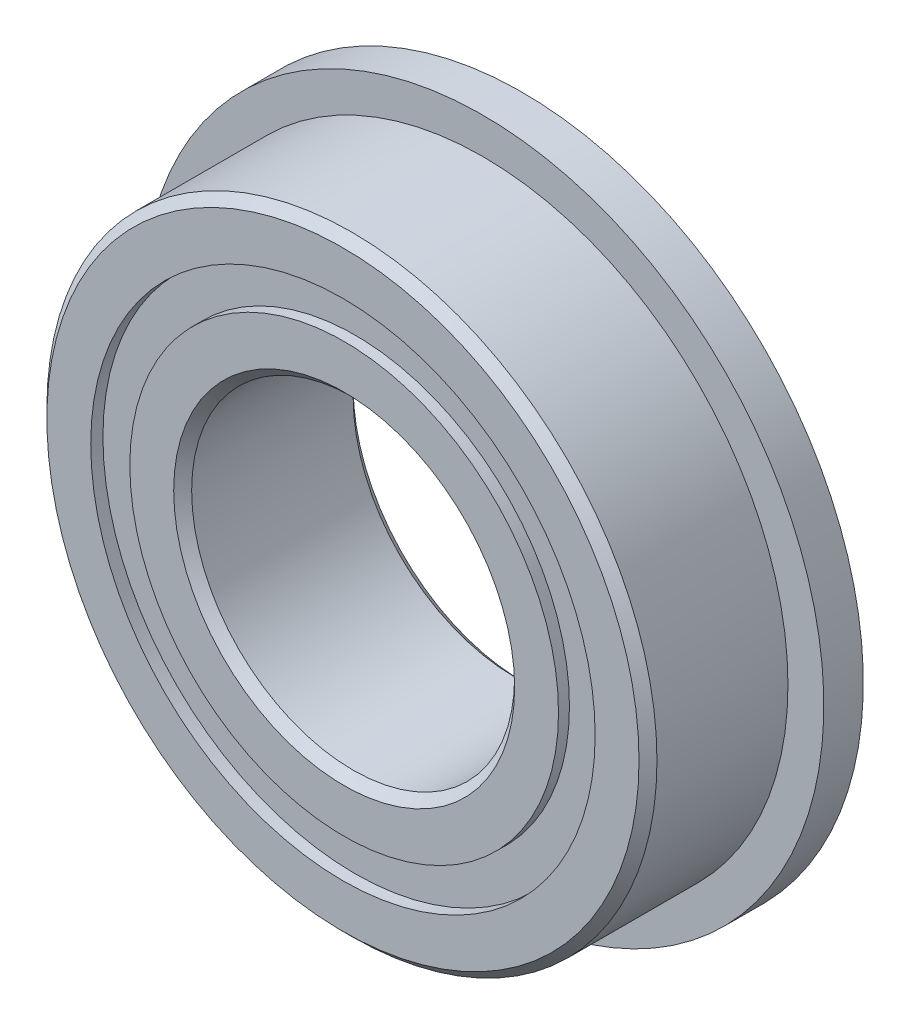
from build123d import *

# Parameters (mm, degrees)
CIRPATTERN1_COUNT    = 12
SKETCH5_W            = 1.145042615
SKETCH5_H            = 1.054945054
SKETCH6_W            = 1.1
SKETCH6_H            = 2.472527473
SCALE1_OUTLINE_W     = 0.055555556
SCALE1_OUTLINE_H     = 0.117750197
SCALE1_START         = 1.229957385
SCALE1_5_OUTLINE_R   = 6.636141636
SCALE1_5_OUTLINE_R_2 = 5.972527473
SCALE1_5_DEPTH       = 1.145042615
SCALE1_START_2       = 1.166343906
SCALE1_6_OUTLINE_R   = 7.808302808
SCALE1_6_OUTLINE_R_2 = 6.636141636
SCALE1_6_DEPTH       = 1.272269573
SCALE1_START_3       = -2.375
SCALE1_7_OUTLINE_R   = 6.636141636
SCALE1_7_OUTLINE_R_2 = 5.972527473
SCALE1_7_DEPTH       = 1.145042615
SCALE1_START_4       = -2.438613479
SCALE1_8_OUTLINE_R   = 7.808302808
SCALE1_8_OUTLINE_R_2 = 6.636141636
SCALE1_8_DEPTH       = 1.272269573


with BuildPart() as part:
    # Sketch1 → Revolve1 (revolve)
    with BuildSketch(Plane(origin=(0, 0, 0), x_dir=(0, 0, -1), z_dir=(1, 0, 0)), mode=Mode.PRIVATE) as revolve1_sk:
        with BuildLine():
            Line((2.25, 8.5), (-2.25, 8.5))
            Line((-2.25, 8.5), (-2.5, 8.25))
            Line((-2.5, 8.25), (-2.5, 7.027472527))
            Line((-2.5, 7.027472527), (-1.111111111, 7.027472527))
            ThreePointArc((-1.111111111, 7.027472527), (0, 7.729957385), (1.111111111, 7.027472527))
            Line((1.111111111, 7.027472527), (2.5, 7.027472527))
            Line((2.5, 7.027472527), (2.5, 8.25))
            Line((2.5, 8.25), (2.25, 8.5))
        make_face()
    revolve(revolve1_sk.sketch.rotate(Axis((0, 0, 2.5), (0, 0, -1)), 90), axis=Axis((0, 0, 2.5), (0, 0, -1)))

    # Sketch6 → Revolve6 (revolve)
    with BuildSketch(Plane(origin=(0, 0, 0), x_dir=(0, 0, -1), z_dir=(1, 0, 0)), mode=Mode.PRIVATE) as revolve6_sk:
        with Locations((1.95, 8.263736264)):
            Rectangle(SKETCH6_W, SKETCH6_H)
    revolve(revolve6_sk.sketch.rotate(Axis((0, 0, -2.5), (0, 0, 1)), 270), axis=Axis((0, 0, -2.5), (0, 0, 1)))

    # Scale1: read off the stored shape, not the designer's step
    # Scale1 outline → Scale1 (revolve, cut)
    with BuildSketch(Plane.XZ):
        with Locations((9.472222222, -1.458875099)):
            Rectangle(SCALE1_OUTLINE_W, SCALE1_OUTLINE_H)
        with BuildLine():
            Line((7.808302808, 1.27237326), (7.808302808, 2.5))
            Line((7.808302808, 2.5), (7.027472527, 2.5))
            Line((7.027472527, 2.5), (7.027472527, 1.111111111))
            ThreePointArc((7.027472527, 1.111111111), (7.729957385, 0), (7.027472527, -1.111111111))
            Line((7.027472527, -1.111111111), (7.027472527, -2.5))
            Line((7.027472527, -2.5), (7.808302808, -2.5))
            Line((7.808302808, -2.5), (7.808302808, -1.196762542))
            ThreePointArc((7.808302808, -1.196762542), (8.226746068, -0.888790669), (8.5, -0.446892802))
            Line((8.5, -0.446892802), (8.5, 0.52250352))
            ThreePointArc((8.5, 0.52250352), (8.226746068, 0.964401387), (7.808302808, 1.27237326))
        make_face()
    revolve(axis=Axis((0, 0, 0), (0, 0, 1)), mode=Mode.SUBTRACT)

    # Scale1 2 outline → Scale1 2 (revolve)
    with BuildSketch(Plane.XZ):
        with BuildLine():
            Line((9.444444444, 2.537805359), (9.166666667, 2.815583137))
            Line((9.166666667, 2.815583137), (7.808302808, 2.815583137))
            Line((7.808302808, 2.815583137), (7.808302808, 2.5))
            Line((7.808302808, 2.5), (8.25, 2.5))
            Line((8.25, 2.5), (8.5, 2.25))
            Line((8.5, 2.25), (8.5, 0.52250352))
            ThreePointArc((8.5, 0.52250352), (8.588841539, 0.037805359), (8.5, -0.446892802))
            Line((8.5, -0.446892802), (8.5, -1.4))
            Line((8.5, -1.4), (9.444444444, -1.4))
            Line((9.444444444, -1.4), (9.444444444, 2.537805359))
        make_face()
        Polygon((10.555555556, -1.517750197), (9.5, -1.517750197), (9.5, -2.5), (7.808302808, -2.5), (7.808302808, -2.739972419), (10.555555556, -2.739972419), align=None)
    revolve(axis=Axis((0, 0, 0), (0, 0, 1)))


with BuildPart() as body_2:
    # Sketch3 → Revolve3 (revolve)
    with BuildSketch(Plane(origin=(0, 0, 0), x_dir=(0, 0, -1), z_dir=(1, 0, 0)), mode=Mode.PRIVATE) as revolve3_sk:
        with BuildLine():
            Line((-2.5, 5.972527473), (-1.111111111, 5.972527473))
            ThreePointArc((-1.111111111, 5.972527473), (0, 5.270042615), (1.111111111, 5.972527473))
            Line((1.111111111, 5.972527473), (2.5, 5.972527473))
            Line((2.5, 5.972527473), (2.5, 4.75))
            Line((2.5, 4.75), (2.25, 4.5))
            Line((2.25, 4.5), (-2.25, 4.5))
            Line((-2.25, 4.5), (-2.5, 4.75))
            Line((-2.5, 4.75), (-2.5, 5.972527473))
        make_face()
    revolve(revolve3_sk.sketch.rotate(Axis((0, 0, 2.5), (0, 0, -1)), 90), axis=Axis((0, 0, 2.5), (0, 0, -1)))

    # Scale1 3 outline → Scale1 3 (revolve, cut)
    with BuildSketch(Plane.XZ):
        Polygon((5, -2.5), (5, 2.5), (4.75, 2.5), (4.5, 2.25), (4.5, -2.25), (4.75, -2.5), align=None)
    revolve(axis=Axis((0, 0, 0), (0, 0, 1)), mode=Mode.SUBTRACT)

    # Scale1 4 outline → Scale1 4 (revolve)
    with BuildSketch(Plane.XZ):
        with BuildLine():
            Line((5.277777778, 2.777777778), (5, 2.5))
            Line((5, 2.5), (5.972527473, 2.5))
            Line((5.972527473, 2.5), (5.972527473, 1.111111111))
            ThreePointArc((5.972527473, 1.111111111), (5.270042615, 0), (5.972527473, -1.111111111))
            Line((5.972527473, -1.111111111), (5.972527473, -2.5))
            Line((5.972527473, -2.5), (5, -2.5))
            Line((5, -2.5), (5.277777778, -2.777777778))
            Line((5.277777778, -2.777777778), (6.636141636, -2.777777778))
            Line((6.636141636, -2.777777778), (6.636141636, -1.234567901))
            ThreePointArc((6.636141636, -1.234567901), (5.855602906, 0), (6.636141636, 1.234567901))
            Line((6.636141636, 1.234567901), (6.636141636, 2.777777778))
            Line((6.636141636, 2.777777778), (5.277777778, 2.777777778))
        make_face()
    revolve(axis=Axis((0, 0, 0), (0, 0, 1)))


with BuildPart() as body_3:
    # Sketch4 → Revolve4 (revolve)
    with BuildSketch(Plane(origin=(0, 0, 0), x_dir=(0, 0, -1), z_dir=(1, 0, 0))):
        with BuildLine():
            Line((-1.229957385, 6.5), (1.229957385, 6.5))
            ThreePointArc((1.229957385, 6.5), (0, 7.729957385), (-1.229957385, 6.5))
        make_face()
    revolve(axis=Axis((0, 6.5, 1.229957385), (0, 0, -1)))


with BuildPart() as cirpattern1_1:
    # CirPattern1: pattern copy
    add(body_3.part.rotate(Axis((0, 0, 0), (0, 0, 1)), 1 * 360 / CIRPATTERN1_COUNT))


with BuildPart() as cirpattern1_2:
    # CirPattern1: pattern copy
    add(body_3.part.rotate(Axis((0, 0, 0), (0, 0, 1)), 2 * 360 / CIRPATTERN1_COUNT))


with BuildPart() as cirpattern1_3:
    # CirPattern1: pattern copy
    add(body_3.part.rotate(Axis((0, 0, 0), (0, 0, 1)), 3 * 360 / CIRPATTERN1_COUNT))


with BuildPart() as cirpattern1_4:
    # CirPattern1: pattern copy
    add(body_3.part.rotate(Axis((0, 0, 0), (0, 0, 1)), 4 * 360 / CIRPATTERN1_COUNT))


with BuildPart() as cirpattern1_5:
    # CirPattern1: pattern copy
    add(body_3.part.rotate(Axis((0, 0, 0), (0, 0, 1)), 5 * 360 / CIRPATTERN1_COUNT))


with BuildPart() as cirpattern1_6:
    # CirPattern1: pattern copy
    add(body_3.part.rotate(Axis((0, 0, 0), (0, 0, 1)), 6 * 360 / CIRPATTERN1_COUNT))


with BuildPart() as cirpattern1_7:
    # CirPattern1: pattern copy
    add(body_3.part.rotate(Axis((0, 0, 0), (0, 0, 1)), 7 * 360 / CIRPATTERN1_COUNT))


with BuildPart() as cirpattern1_8:
    # CirPattern1: pattern copy
    add(body_3.part.rotate(Axis((0, 0, 0), (0, 0, 1)), 8 * 360 / CIRPATTERN1_COUNT))


with BuildPart() as cirpattern1_9:
    # CirPattern1: pattern copy
    add(body_3.part.rotate(Axis((0, 0, 0), (0, 0, 1)), 9 * 360 / CIRPATTERN1_COUNT))


with BuildPart() as cirpattern1_10:
    # CirPattern1: pattern copy
    add(body_3.part.rotate(Axis((0, 0, 0), (0, 0, 1)), 10 * 360 / CIRPATTERN1_COUNT))


with BuildPart() as cirpattern1_11:
    # CirPattern1: pattern copy
    add(body_3.part.rotate(Axis((0, 0, 0), (0, 0, 1)), 11 * 360 / CIRPATTERN1_COUNT))


with BuildPart() as body_15:
    # Sketch5 → Revolve5 (revolve)
    with BuildSketch(Plane(origin=(0, 0, 0), x_dir=(0, 0, -1), z_dir=(1, 0, 0)), mode=Mode.PRIVATE) as revolve5_sk:
        with Locations((-1.802478693, 6.5)):
            Rectangle(SKETCH5_W, SKETCH5_H)
        with Locations((1.802478693, 6.5)):
            Rectangle(SKETCH5_W, SKETCH5_H)
    revolve(revolve5_sk.sketch.rotate(Axis((0, 0, 2.5), (0, 0, -1)), 90), axis=Axis((0, 0, 2.5), (0, 0, -1)))

    # Scale1 5 outline → Scale1 5 (cut)
    with BuildSketch(Plane.XY.offset(SCALE1_START)):
        Circle(SCALE1_5_OUTLINE_R)
        Circle(SCALE1_5_OUTLINE_R_2, mode=Mode.SUBTRACT)
    extrude(amount=SCALE1_5_DEPTH, mode=Mode.SUBTRACT)

    # Scale1 6 outline → Scale1 6 (add)
    with BuildSketch(Plane.XY.offset(SCALE1_START_2)):
        Circle(SCALE1_6_OUTLINE_R)
        Circle(SCALE1_6_OUTLINE_R_2, mode=Mode.SUBTRACT)
    extrude(amount=SCALE1_6_DEPTH)

    # Scale1 7 outline → Scale1 7 (cut)
    with BuildSketch(Plane.XY.offset(SCALE1_START_3)):
        Circle(SCALE1_7_OUTLINE_R)
        Circle(SCALE1_7_OUTLINE_R_2, mode=Mode.SUBTRACT)
    extrude(amount=SCALE1_7_DEPTH, mode=Mode.SUBTRACT)

    # Scale1 8 outline → Scale1 8 (add)
    with BuildSketch(Plane.XY.offset(SCALE1_START_4)):
        Circle(SCALE1_8_OUTLINE_R)
        Circle(SCALE1_8_OUTLINE_R_2, mode=Mode.SUBTRACT)
    extrude(amount=SCALE1_8_DEPTH)


solid = Compound([part.part, body_2.part, body_3.part, cirpattern1_1.part, cirpattern1_2.part, cirpattern1_3.part, cirpattern1_4.part, cirpattern1_5.part, cirpattern1_6.part, cirpattern1_7.part, cirpattern1_8.part, cirpattern1_9.part, cirpattern1_10.part, cirpattern1_11.part, body_15.part])
